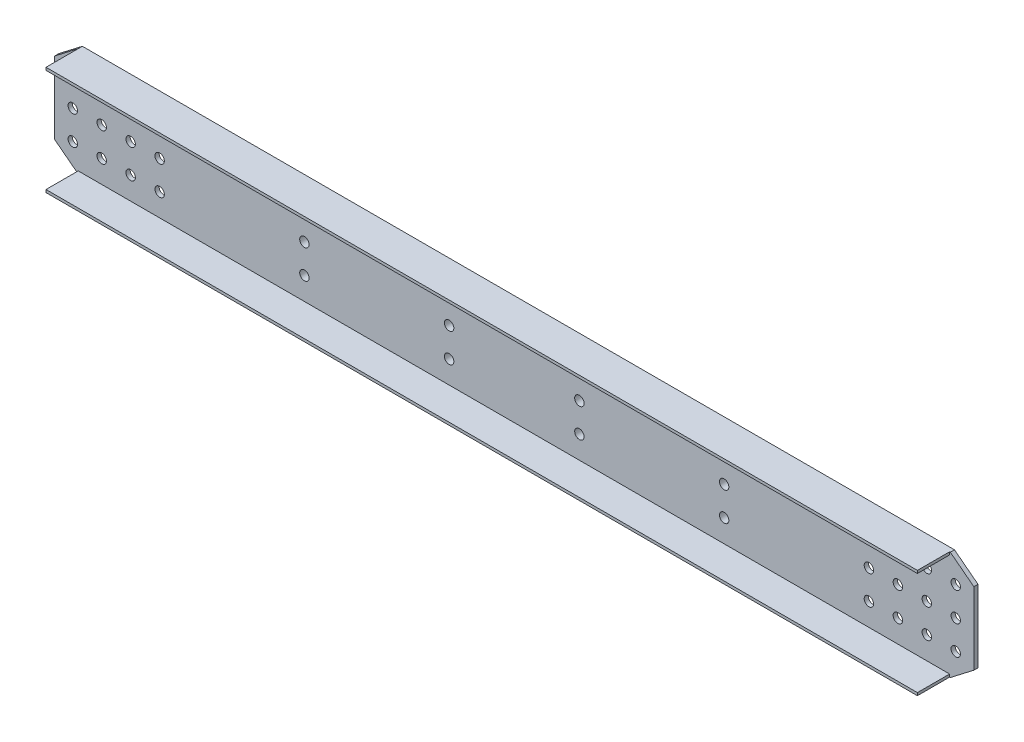
from build123d import *

# Parameters (mm, degrees)
SKETCH_1_R          = 13
EXTRUDE_730_DEPTH   = 11.5
SKETCH_2_W          = 2408.049034164
SKETCH_2_H          = 7.5
EXTRUDE_1_DEPTH     = 89
SKETCH_3_W          = 80
SKETCH_3_H          = 240
EXTRUDE_2_DEPTH     = 16
SKETCH_4_R          = 13
CUT_EXTRUDE_1_DEPTH = 1308.983562588


with BuildPart() as part:
    # 草图1 → Extrude 730 (new body)
    with BuildSketch(Plane.XY):
        Polygon((-1205, 0), (1205, 0), (1270, 50), (1270, 250), (1205, 300), (-1205, 300), (-1270, 250), (-1270, 50), align=None)
        with Locations((-1220, 230)):
            Circle(SKETCH_1_R, mode=Mode.SUBTRACT)
        with Locations((-1220, 150)):
            Circle(SKETCH_1_R, mode=Mode.SUBTRACT)
        with Locations((-1140, 230)):
            Circle(SKETCH_1_R, mode=Mode.SUBTRACT)
        with Locations((-1140, 150)):
            Circle(SKETCH_1_R, mode=Mode.SUBTRACT)
        with Locations((-1060, 230)):
            Circle(SKETCH_1_R, mode=Mode.SUBTRACT)
        with Locations((-1060, 150)):
            Circle(SKETCH_1_R, mode=Mode.SUBTRACT)
        with Locations((-980, 150)):
            Circle(SKETCH_1_R, mode=Mode.SUBTRACT)
        with Locations((-1060, 70)):
            Circle(SKETCH_1_R, mode=Mode.SUBTRACT)
        with Locations((-1140, 70)):
            Circle(SKETCH_1_R, mode=Mode.SUBTRACT)
        with Locations((-1220, 70)):
            Circle(SKETCH_1_R, mode=Mode.SUBTRACT)
        with Locations((1220, 70)):
            Circle(SKETCH_1_R, mode=Mode.SUBTRACT)
        with Locations((1140, 70)):
            Circle(SKETCH_1_R, mode=Mode.SUBTRACT)
        with Locations((1060, 70)):
            Circle(SKETCH_1_R, mode=Mode.SUBTRACT)
        with Locations((980, 150)):
            Circle(SKETCH_1_R, mode=Mode.SUBTRACT)
        with Locations((1060, 150)):
            Circle(SKETCH_1_R, mode=Mode.SUBTRACT)
        with Locations((1060, 230)):
            Circle(SKETCH_1_R, mode=Mode.SUBTRACT)
        with Locations((1140, 150)):
            Circle(SKETCH_1_R, mode=Mode.SUBTRACT)
        with Locations((1140, 230)):
            Circle(SKETCH_1_R, mode=Mode.SUBTRACT)
        with Locations((1220, 150)):
            Circle(SKETCH_1_R, mode=Mode.SUBTRACT)
        with Locations((1220, 230)):
            Circle(SKETCH_1_R, mode=Mode.SUBTRACT)
        with Locations((-980, 70)):
            Circle(SKETCH_1_R, mode=Mode.SUBTRACT)
        with Locations((-980, 230)):
            Circle(SKETCH_1_R, mode=Mode.SUBTRACT)
        with Locations((980, 70)):
            Circle(SKETCH_1_R, mode=Mode.SUBTRACT)
        with Locations((980, 230)):
            Circle(SKETCH_1_R, mode=Mode.SUBTRACT)
    extrude(amount=-EXTRUDE_730_DEPTH)

    # 草图2 → 凸台-拉伸1 (add)
    with BuildSketch(Plane.XY):
        with Locations((-0.975482918, 296.25)):
            Rectangle(SKETCH_2_W, SKETCH_2_H)
        with Locations((-0.975482918, 3.75)):
            Rectangle(SKETCH_2_W, SKETCH_2_H)
    extrude(amount=EXTRUDE_1_DEPTH)

    # 草图3 → 凸台-拉伸2 (add)
    with BuildSketch(Plane(origin=(0, 0, -11.5), x_dir=(-1, 0, 0), z_dir=(0, 0, -1))):
        with Locations((-580, 150)):
            Rectangle(SKETCH_3_W, SKETCH_3_H)
        with Locations((-180, 150)):
            Rectangle(SKETCH_3_W, SKETCH_3_H)
        with Locations((180, 150)):
            Rectangle(SKETCH_3_W, SKETCH_3_H)
        with Locations((580, 150)):
            Rectangle(SKETCH_3_W, SKETCH_3_H)
    extrude(amount=EXTRUDE_2_DEPTH)

    # 草图4 → 切除-拉伸1 (cut, through all)
    with BuildSketch(Plane.XY):
        with Locations((-580, 230)):
            Circle(SKETCH_4_R)
        with Locations((-580, 150)):
            Circle(SKETCH_4_R)
        with Locations((-180, 230)):
            Circle(SKETCH_4_R)
        with Locations((-180, 150)):
            Circle(SKETCH_4_R)
        with Locations((-180, 70)):
            Circle(SKETCH_4_R)
        with Locations((-580, 70)):
            Circle(SKETCH_4_R)
        with Locations((580, 70)):
            Circle(SKETCH_4_R)
        with Locations((180, 70)):
            Circle(SKETCH_4_R)
        with Locations((180, 150)):
            Circle(SKETCH_4_R)
        with Locations((180, 230)):
            Circle(SKETCH_4_R)
        with Locations((580, 150)):
            Circle(SKETCH_4_R)
        with Locations((580, 230)):
            Circle(SKETCH_4_R)
    extrude(amount=-CUT_EXTRUDE_1_DEPTH, mode=Mode.SUBTRACT)


solid = part.part
